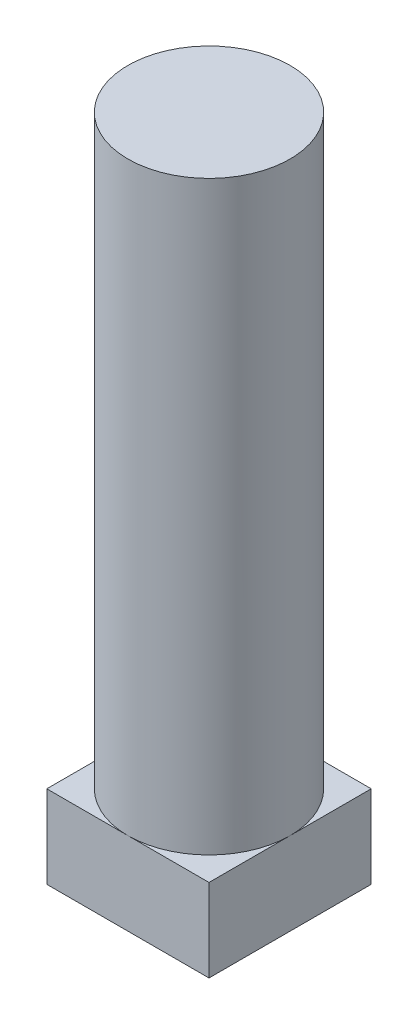
from build123d import *

# Parameters (mm, degrees)
SKETCH1_W           = 4.9
SKETCH1_H           = 4.9
BOSS_EXTRUDE1_DEPTH = 2.5
SKETCH2_R           = 2.45
BOSS_EXTRUDE2_DEPTH = 17.7


with BuildPart() as part:
    # Sketch1 → Boss-Extrude1 (new body)
    with BuildSketch(Plane(origin=(0, 0, 0), x_dir=(1, 0, 0), z_dir=(0, 1, 0))):
        Rectangle(SKETCH1_W, SKETCH1_H)
    extrude(amount=BOSS_EXTRUDE1_DEPTH)

    # Sketch2 → Boss-Extrude2 (add)
    with BuildSketch(Plane(origin=(0, 2.5, 0), x_dir=(1, 0, 0), z_dir=(0, 1, 0))):
        Circle(SKETCH2_R)
    extrude(amount=BOSS_EXTRUDE2_DEPTH)


solid = part.part
